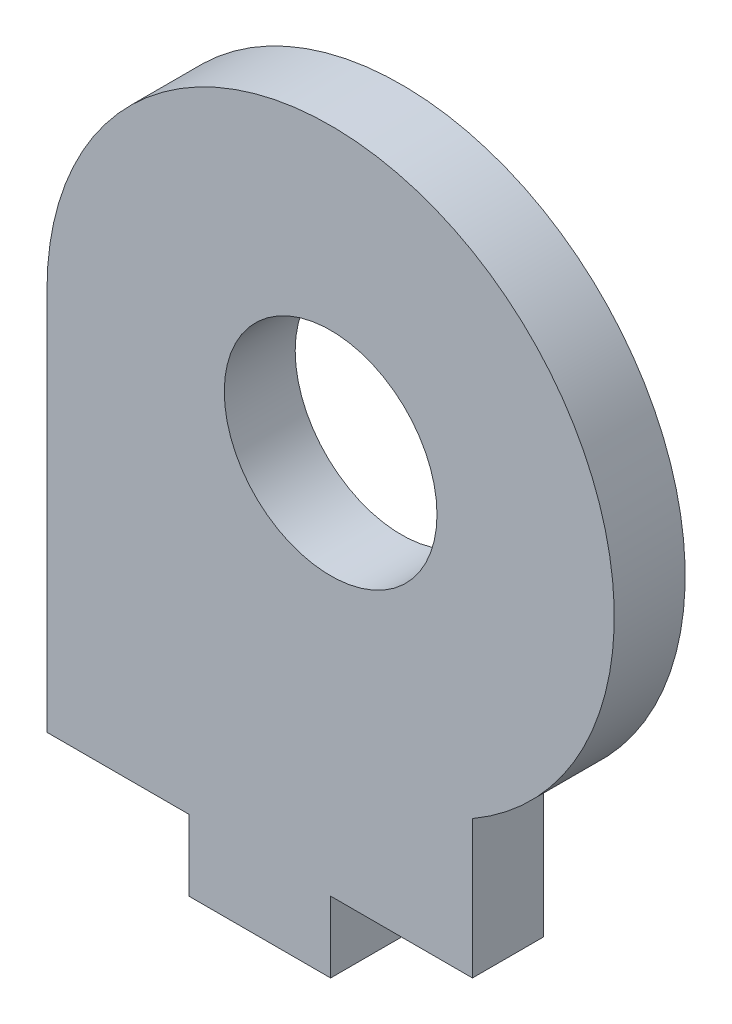
from build123d import *

# Parameters (mm, degrees)
SKETCH1_R           = 4.7625
BOSS_EXTRUDE1_DEPTH = 3.175
SKETCH2_W           = 6.35
SKETCH2_H           = 3.175
CUT_EXTRUDE1_DEPTH  = 3.175


with BuildPart() as part:
    # Sketch1 → Boss-Extrude1 (new body)
    with BuildSketch(Plane.XY):
        with BuildLine():
            Line((7.987675642, 20.35683), (7.987675642, 0))
            Line((7.987675642, 0), (27.037675642, 0))
            Line((27.037675642, 0), (27.037675642, 9.358307372))
            ThreePointArc((27.037675642, 9.358307372), (27.037675642, 31.355352628), (7.987675642, 20.35683))
        make_face()
        with Locations((20.687675642, 20.35683)):
            Circle(SKETCH1_R, mode=Mode.SUBTRACT)
    extrude(amount=BOSS_EXTRUDE1_DEPTH)

    # Sketch2 → Cut-Extrude1 (cut)
    with BuildSketch(Plane.XZ):
        with Locations((11.162675642, 1.5875)):
            Rectangle(SKETCH2_W, SKETCH2_H)
        with Locations((23.862675642, 1.5875)):
            Rectangle(SKETCH2_W, SKETCH2_H)
    extrude(amount=-CUT_EXTRUDE1_DEPTH, mode=Mode.SUBTRACT)


solid = part.part
